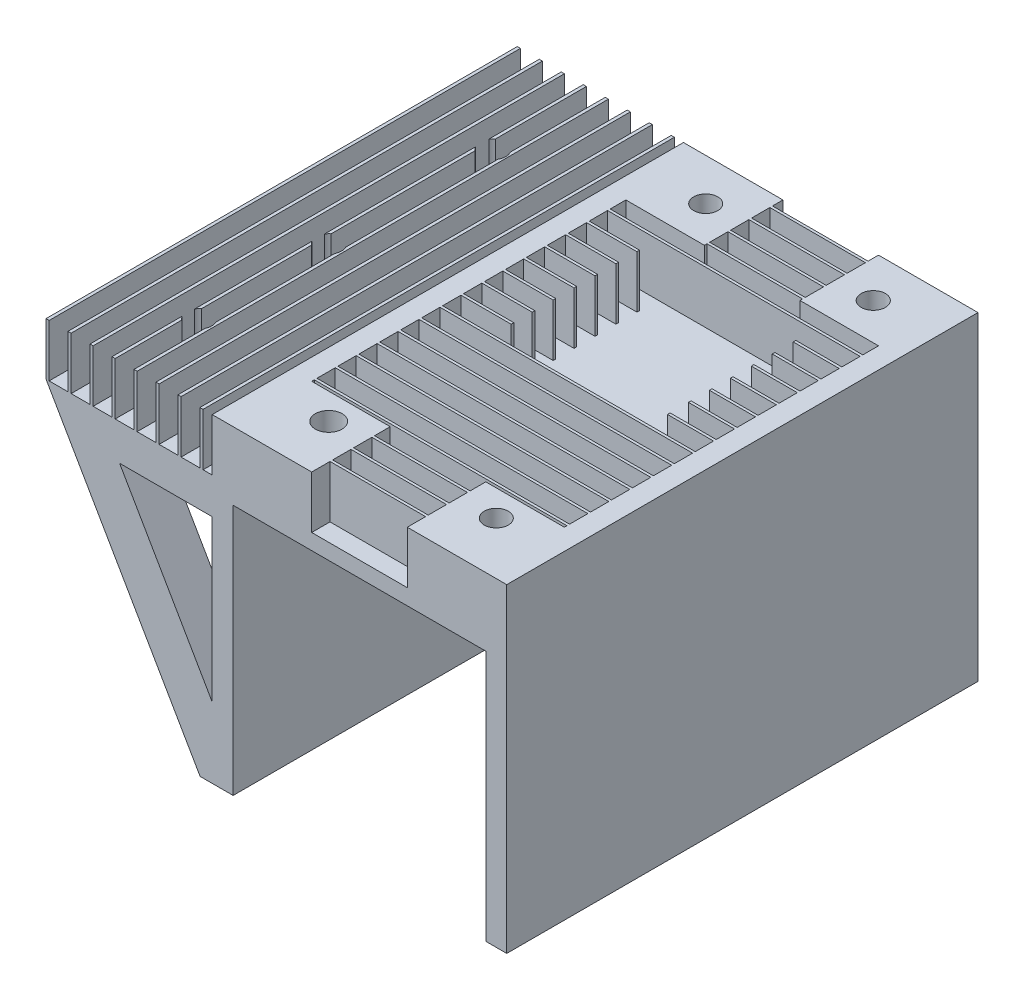
from build123d import *
from build123d.topology import SkipClean

# Parameters (mm, degrees)
SKETCH1_W            = 48.254
SKETCH1_H            = 10
BOSS_EXTRUDE1_DEPTH  = 70
BOSS_EXTRUDE3_DEPTH  = 8
BOSS_EXTRUDE4_DEPTH  = 8
BOSS_EXTRUDE5_DEPTH  = 8
BOSS_EXTRUDE6_DEPTH  = 70
SKETCH7_W            = 40.394634483
SKETCH7_H            = 17
CUT_EXTRUDE3_DEPTH   = 70
BOSS_EXTRUDE7_DEPTH  = 70
BOSS_EXTRUDE10_DEPTH = 8
BOSS_EXTRUDE11_DEPTH = 70
SKETCH13_W           = 83.001411072
SKETCH13_H           = 87.868559997
CUT_EXTRUDE4_DEPTH   = 4
SKETCH14_W           = 48.254
SKETCH14_H           = 10
BOSS_EXTRUDE12_DEPTH = 20
SKETCH16_W           = 56.254
SKETCH16_H           = 5
CUT_EXTRUDE5_DEPTH   = 100
SKETCH17_W           = 15
SKETCH17_H           = 15
BOSS_EXTRUDE14_DEPTH = 13
CUT_EXTRUDE8_DEPTH   = 5
SKETCH21_R           = 2.3
CUT_EXTRUDE9_DEPTH   = 15
SKETCH23_W           = 12
SKETCH23_H           = 40.530858039
CUT_EXTRUDE10_DEPTH  = 9
SKETCH25_R           = 2.3
CUT_EXTRUDE11_DEPTH  = 20
SKETCH26_R           = 2.3
CUT_EXTRUDE12_DEPTH  = 20
BOSS_EXTRUDE16_DEPTH = 20
SKETCH28_W           = 15
SKETCH28_H           = 15
BOSS_EXTRUDE17_DEPTH = 10
SKETCH29_R           = 2.3
CUT_EXTRUDE13_DEPTH  = 20
SKETCH30_W           = 10.391026801
SKETCH30_H           = 12
BOSS_EXTRUDE18_DEPTH = 5
SKETCH31_R           = 2.3
CUT_EXTRUDE14_DEPTH  = 45
SKETCH36_W           = 0.6
SKETCH36_H           = 90
BOSS_EXTRUDE19_DEPTH = 10
SKETCH37_W           = 49
SKETCH37_H           = 0.5
BOSS_EXTRUDE20_DEPTH = 10
CUT_EXTRUDE15_START  = -10
SKETCH39_R           = 2.3
SKETCH39_R_2         = 2.442118341
SKETCH39_R_3         = 2.213761507
SKETCH39_W           = 29.845843403
SKETCH39_H           = 29.001149721
CUT_EXTRUDE15_DEPTH  = 10
CUT_EXTRUDE16_START  = -30
SKETCH40_R           = 2.273179605
SKETCH40_R_2         = 2.382700243
SKETCH40_R_3         = 2.382778694
SKETCH40_R_4         = 2.560712358
SKETCH40_R_5         = 2.279147798
SKETCH40_R_6         = 2.311246158
SKETCH40_R_7         = 2.3
CUT_EXTRUDE16_DEPTH  = 30


with BuildPart() as part:
    # Sketch1 → Boss-Extrude1 (new body)
    with BuildSketch(Plane.XY):
        Polygon((0, 70), (0, 0), (4, 0), (4, 52), (52.254, 52), (52.254, 0), (56.254, 0), (56.254, 70), align=None)
        with Locations((28.127, 60)):
            Rectangle(SKETCH1_W, SKETCH1_H, mode=Mode.SUBTRACT)
    extrude(amount=BOSS_EXTRUDE1_DEPTH)

    # Sketch3 → Boss-Extrude3 (add)
    with BuildSketch(Plane.XY.offset(70)):
        Polygon((0, 62.5), (0, 70), (-40.394634483, 70), (0, 0.034440722), (0, 17.466679003), (-26, 62.5), align=None)
    extrude(amount=-BOSS_EXTRUDE3_DEPTH)

    # Sketch4 → Boss-Extrude4 (add)
    with BuildSketch(Plane(origin=(0, 0, 0), x_dir=(-1, 0, 0), z_dir=(0, 0, -1))):
        Polygon((0, 70), (40.394634483, 70), (0, 0), (0, 17.466679003), (26, 62.5), (0, 62.5), align=None)
    extrude(amount=-BOSS_EXTRUDE4_DEPTH)

    # Sketch5 → Boss-Extrude5 (add)
    with BuildSketch(Plane(origin=(0, 0, 39), x_dir=(-1, 0, 0), z_dir=(0, 0, -1))):
        Polygon((0, 62.5), (0, 70), (40.394634483, 70), (0, 0), (0, 17.466679003), (26, 62.5), align=None)
    extrude(amount=BOSS_EXTRUDE5_DEPTH)

    # Sketch6 → Boss-Extrude6 (add)
    with BuildSketch(Plane(origin=(0, 0, 0), x_dir=(-1, 0, 0), z_dir=(0, 0, -1))):
        Polygon((0, 62.5), (36.066637932, 62.5), (40.394634483, 70), (0, 70), align=None)
        Polygon((-4, 0), (0, 0), (7.50186069, 13), (-4, 13), align=None)
    extrude(amount=-BOSS_EXTRUDE6_DEPTH)

    # Sketch7 → Cut-Extrude3 (cut)
    with BuildSketch(Plane.XY.offset(70)):
        with Locations((-20.197317242, 61.5)):
            Rectangle(SKETCH7_W, SKETCH7_H)
    extrude(amount=-CUT_EXTRUDE3_DEPTH, mode=Mode.SUBTRACT)

    # Sketch8 → Boss-Extrude7 (add)
    with BuildSketch(Plane(origin=(0, 0, 0), x_dir=(-1, 0, 0), z_dir=(0, 0, -1))):
        Polygon((-4, 55), (-4, 52), (30.007442759, 52), (31.73864138, 55), align=None)
    extrude(amount=-BOSS_EXTRUDE7_DEPTH)

    # Sketch11 → Boss-Extrude10 (add)
    with BuildSketch(Plane.XY.offset(70)):
        Polygon((-31.73864138, 55), (0, 0), (-3.053687451, 13), (-27.288965695, 55), align=None)
    extrude(amount=-BOSS_EXTRUDE10_DEPTH)

    # Sketch12 → Boss-Extrude11 (add)
    with BuildSketch(Plane.XY.offset(70)):
        Polygon((-31.73864138, 55), (-27.75981023, 48.105069917), (0, 48.105069917), (0, 55), align=None)
    extrude(amount=-BOSS_EXTRUDE11_DEPTH)

    # Sketch13 → Cut-Extrude4 (cut)
    with BuildSketch(Plane.XZ):
        with Locations((25.938658228, 33.313825886)):
            Rectangle(SKETCH13_W, SKETCH13_H)
    extrude(amount=-CUT_EXTRUDE4_DEPTH, mode=Mode.SUBTRACT)

    # Sketch14 → Boss-Extrude12 (add)
    with BuildSketch(Plane.XY.offset(70)):
        Polygon((-2.308264828, 4), (-31.73864138, 55), (0, 55), (0, 70), (56.254, 70), (56.254, 4), (52.254, 4), (52.254, 52), (4, 52), (4, 4), align=None)
        Polygon((-17.689083241, 48.105069917), (0, 48.105069917), (0, 17.466679003), align=None, mode=Mode.SUBTRACT)
        with Locations((28.127, 60)):
            Rectangle(SKETCH14_W, SKETCH14_H, mode=Mode.SUBTRACT)
    extrude(amount=BOSS_EXTRUDE12_DEPTH)

    # Sketch16 → Cut-Extrude5 (cut)
    with BuildSketch(Plane.XY.offset(90)):
        with Locations((28.127, 67.5)):
            Rectangle(SKETCH16_W, SKETCH16_H)
    extrude(amount=-CUT_EXTRUDE5_DEPTH, mode=Mode.SUBTRACT)

    # Sketch17 → Boss-Extrude14 (add)
    with BuildSketch(Plane(origin=(0, 65, 0), x_dir=(1, 0, 0), z_dir=(0, 1, 0))):
        with Locations((44.754, -7.5)):
            Rectangle(SKETCH17_W, SKETCH17_H)
        with Locations((44.754, -82.5)):
            Rectangle(SKETCH17_W, SKETCH17_H)
    extrude(amount=-BOSS_EXTRUDE14_DEPTH)

    # Sketch22 → Cut-Extrude8 (cut)
    with BuildSketch(Plane.XZ.offset(-52)):
        Polygon((48.096455918, 6.003620146), (47.904143628, 10.329474511), (44.06168771, 12.325854365), (40.411544082, 9.996379854), (40.603856372, 5.670525489), (44.44631229, 3.674145635), align=None)
        Polygon((45.200685086, 75.774625774), (48.386623963, 78.707166221), (47.439938877, 82.932540447), (43.307314914, 84.225374226), (40.121376037, 81.292833779), (41.068061123, 77.067459553), align=None)
    extrude(amount=-CUT_EXTRUDE8_DEPTH, mode=Mode.SUBTRACT)

    # Sketch21 → Cut-Extrude9 (cut)
    with BuildSketch(Plane(origin=(0, 52, 0), x_dir=(-1, 0, 0), z_dir=(0, -1, 0))):
        with Locations((-44.254, -80)):
            Circle(SKETCH21_R)
        with Locations((-44.254, -8)):
            Circle(SKETCH21_R)
    extrude(amount=-CUT_EXTRUDE9_DEPTH, mode=Mode.SUBTRACT)

    # Sketch23 → Cut-Extrude10 (cut)
    with BuildSketch(Plane(origin=(0, 0, 0), x_dir=(0, 0, 1), z_dir=(-0.8661319205837115, -0.49981546209173167, 0))):
        with Locations((76, 35.274689955)):
            Rectangle(SKETCH23_W, SKETCH23_H)
    extrude(amount=-CUT_EXTRUDE10_DEPTH, mode=Mode.SUBTRACT)

    # Sketch25 → Cut-Extrude11 (cut)
    with BuildSketch(Plane(origin=(0, 48.105069917, 0), x_dir=(-1, 0, 0), z_dir=(0, -1, 0))):
        with Locations((17.075514089, -19.30064897)):
            Circle(SKETCH25_R)
        with Locations((17.075514089, -50.613733273)):
            Circle(SKETCH25_R)
    extrude(amount=-CUT_EXTRUDE11_DEPTH, mode=Mode.SUBTRACT)

    # Sketch26 → Cut-Extrude12 (cut)
    with BuildSketch(Plane.XZ.offset(-48.105069917)):
        with Locations((-17.075514089, 75.391336138)):
            Circle(SKETCH26_R)
    extrude(amount=-CUT_EXTRUDE12_DEPTH, mode=Mode.SUBTRACT)

    # Sketch27 → Boss-Extrude16 (add)
    with BuildSketch(Plane.XY.offset(90)):
        Polygon((-23.310381194, 48.105069917), (-27.75981023, 48.105069917), (-31.73864138, 55), (-23.310381194, 55), align=None)
    extrude(amount=-BOSS_EXTRUDE16_DEPTH)

    # Sketch28 → Boss-Extrude17 (add)
    with BuildSketch(Plane(origin=(0, 55, 0), x_dir=(1, 0, 0), z_dir=(0, 1, 0))):
        with Locations((11.5, -7.5)):
            Rectangle(SKETCH28_W, SKETCH28_H)
        with Locations((11.5, -82.5)):
            Rectangle(SKETCH28_W, SKETCH28_H)
    extrude(amount=BOSS_EXTRUDE17_DEPTH)

    # Sketch29 → Cut-Extrude13 (cut)
    with BuildSketch(Plane(origin=(0, 52, 0), x_dir=(-1, 0, 0), z_dir=(0, -1, 0))):
        with Locations((-12.254, -8)):
            Circle(SKETCH29_R)
        with Locations((-12.254, -80)):
            Circle(SKETCH29_R)
    extrude(amount=-CUT_EXTRUDE13_DEPTH, mode=Mode.SUBTRACT)

    # Sketch30 → Boss-Extrude18 (add)
    with BuildSketch(Plane.XZ.offset(-48.105069917)):
        with Locations((-22.56429683, 76)):
            Rectangle(SKETCH30_W, SKETCH30_H)
    extrude(amount=-BOSS_EXTRUDE18_DEPTH)

    # Sketch31 → Cut-Extrude14 (cut)
    with BuildSketch(Plane.XZ.offset(-48.105069917)):
        with Locations((-17.075514089, 75.391336138)):
            Circle(SKETCH31_R)
    extrude(amount=-CUT_EXTRUDE14_DEPTH, mode=Mode.SUBTRACT)

    # Sketch36 → Boss-Extrude19 (add)
    with BuildSketch(Plane(origin=(0, 55, 0), x_dir=(1, 0, 0), z_dir=(0, 1, 0))):
        with Locations((-31.43864138, -45)):
            Rectangle(SKETCH36_W, SKETCH36_H)
        with Locations((-27.23864138, -45)):
            Rectangle(SKETCH36_W, SKETCH36_H)
        with Locations((-23.03864138, -45)):
            Rectangle(SKETCH36_W, SKETCH36_H)
        with Locations((-18.83864138, -45)):
            Rectangle(SKETCH36_W, SKETCH36_H)
        with Locations((-14.63864138, -45)):
            Rectangle(SKETCH36_W, SKETCH36_H)
        with Locations((-10.43864138, -45)):
            Rectangle(SKETCH36_W, SKETCH36_H)
        with Locations((-6.23864138, -45)):
            Rectangle(SKETCH36_W, SKETCH36_H)
        with Locations((-2.03864138, -45)):
            Rectangle(SKETCH36_W, SKETCH36_H)
    extrude(amount=BOSS_EXTRUDE19_DEPTH)

    # Sketch37 → Boss-Extrude20 (add)
    with BuildSketch(Plane(origin=(0, 55, 0), x_dir=(1, 0, 0), z_dir=(0, 1, 0))):
        with Locations((28.5, -6.25)):
            Rectangle(SKETCH37_W, SKETCH37_H)
        with Locations((28.5, -2.25)):
            Rectangle(SKETCH37_W, SKETCH37_H)
        with Locations((28.5, -10.25)):
            Rectangle(SKETCH37_W, SKETCH37_H)
        with Locations((28.5, -14.25)):
            Rectangle(SKETCH37_W, SKETCH37_H)
        with Locations((28.5, -18.25)):
            Rectangle(SKETCH37_W, SKETCH37_H)
        with Locations((28.5, -22.25)):
            Rectangle(SKETCH37_W, SKETCH37_H)
        with Locations((28.5, -26.25)):
            Rectangle(SKETCH37_W, SKETCH37_H)
        with Locations((28.5, -30.25)):
            Rectangle(SKETCH37_W, SKETCH37_H)
        with Locations((28.5, -34.25)):
            Rectangle(SKETCH37_W, SKETCH37_H)
        with Locations((28.5, -38.25)):
            Rectangle(SKETCH37_W, SKETCH37_H)
        with Locations((28.5, -42.25)):
            Rectangle(SKETCH37_W, SKETCH37_H)
        with Locations((28.5, -46.25)):
            Rectangle(SKETCH37_W, SKETCH37_H)
        with Locations((28.5, -50.25)):
            Rectangle(SKETCH37_W, SKETCH37_H)
        with Locations((28.5, -54.25)):
            Rectangle(SKETCH37_W, SKETCH37_H)
        with Locations((28.5, -58.25)):
            Rectangle(SKETCH37_W, SKETCH37_H)
        with Locations((28.5, -62.25)):
            Rectangle(SKETCH37_W, SKETCH37_H)
        with Locations((28.5, -66.25)):
            Rectangle(SKETCH37_W, SKETCH37_H)
        with Locations((28.5, -70.25)):
            Rectangle(SKETCH37_W, SKETCH37_H)
        with Locations((28.5, -74.25)):
            Rectangle(SKETCH37_W, SKETCH37_H)
        with Locations((28.5, -78.25)):
            Rectangle(SKETCH37_W, SKETCH37_H)
        with Locations((28.5, -82.25)):
            Rectangle(SKETCH37_W, SKETCH37_H)
        with Locations((28.5, -86.25)):
            Rectangle(SKETCH37_W, SKETCH37_H)
    extrude(amount=BOSS_EXTRUDE20_DEPTH)

    # Sketch39 → Cut-Extrude15 (cut)
    with SkipClean():  # the faces are left unmerged after this step: merging them gives an invalid solid
        with BuildSketch(Plane(origin=(0, 65, 0), x_dir=(1, 0, 0), z_dir=(0, 1, 0)).offset(CUT_EXTRUDE15_START)):
            with Locations((12.254, -8)):
                Circle(SKETCH39_R)
            with Locations((44.254, -8)):
                Circle(SKETCH39_R)
            with Locations((-17.075514089, -19.30064897)):
                Circle(SKETCH39_R_2)
            with Locations((-17.075514089, -50.613733273)):
                Circle(SKETCH39_R_3)
            with Locations((-17.075514089, -75.391336138)):
                Circle(SKETCH39_R)
            with Locations((12.254, -80)):
                Circle(SKETCH39_R)
            with Locations((44.254, -80)):
                Circle(SKETCH39_R)
            with Locations((28.532110902, -34.272390249)):
                Rectangle(SKETCH39_W, SKETCH39_H)
        extrude(amount=CUT_EXTRUDE15_DEPTH, mode=Mode.SUBTRACT)
    add(part.part.scale(1), mode=Mode.REPLACE)  # the faces are merged on a copy

    # Sketch40 → Cut-Extrude16 (cut)
    with BuildSketch(Plane(origin=(0, 65, 0), x_dir=(1, 0, 0), z_dir=(0, 1, 0)).offset(CUT_EXTRUDE16_START)):
        with Locations((-17.075514089, -19.30064897)):
            Circle(SKETCH40_R)
        with Locations((-17.075514089, -50.613733273)):
            Circle(SKETCH40_R_2)
        with Locations((-17.075514089, -75.391336138)):
            Circle(SKETCH40_R_3)
        with Locations((12.254, -80)):
            Circle(SKETCH40_R_4)
        with Locations((44.254, -80)):
            Circle(SKETCH40_R_5)
        with Locations((44.254, -8)):
            Circle(SKETCH40_R_6)
        with Locations((12.254, -8)):
            Circle(SKETCH40_R_7)
    extrude(amount=CUT_EXTRUDE16_DEPTH, mode=Mode.SUBTRACT)


solid = part.part
